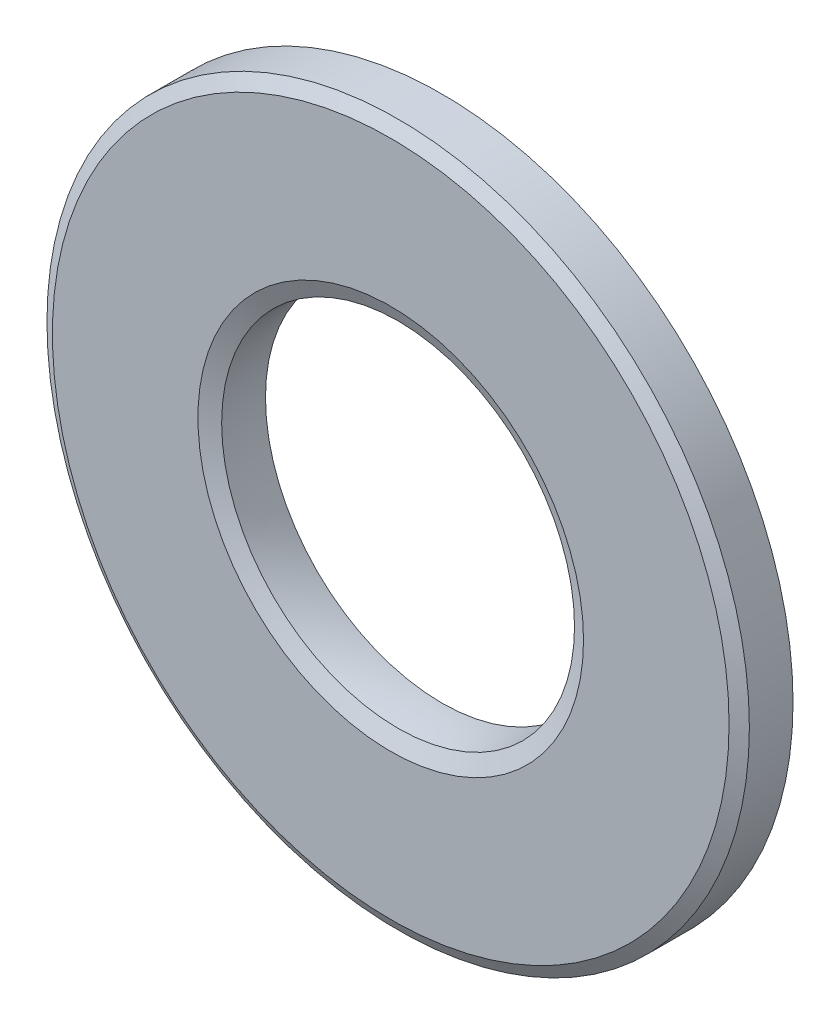
from build123d import *
from OCP.BRepFilletAPI import BRepFilletAPI_MakeChamfer

# Parameters (mm, degrees)
BOSS_EXTRUDE1_DEPTH      = 1
BOSS_EXTRUDE1_DEPTH_BACK = 1
SKETCH3_R                = 12
SKETCH3_R_2              = 6
CHAMFER1_SIZE            = 0.254
CHAMFER1_SIZE2           = 0.439940905
CHAMFER2_SIZE            = 0.536952942


with BuildPart() as part:
    # Sketch3 → Boss-Extrude1 (new, two sides: drawn at the far end of the back side and taken through both)
    with BuildSketch(Plane.XY.offset(-BOSS_EXTRUDE1_DEPTH_BACK)):
        Circle(SKETCH3_R)
        Circle(SKETCH3_R_2, mode=Mode.SUBTRACT)
    extrude(amount=BOSS_EXTRUDE1_DEPTH + BOSS_EXTRUDE1_DEPTH_BACK)

    # Chamfer1: one chamfer whose edges measure the first distance from different faces: ONE call of the kernel's chamfer builder (chamfer() names one face for all edges)
    chamfer1_edges_1 = [part.edges().sort_by_distance(p)[0] for p in [
        (-12, 0, 1),
    ]]
    chamfer1_side_1 = [part.faces().sort_by_distance(p)[0] for p in [
        (-12, 0, 0.5),
    ]]
    chamfer1_edges_2 = [part.edges().sort_by_distance(p)[0] for p in [
        (-12, 0, -1),
    ]]
    chamfer1_side_2 = [part.faces().sort_by_distance(p)[0] for p in [
        (-12, 0, -0.5),
    ]]
    chamfer1 = BRepFilletAPI_MakeChamfer(part.part.solid().wrapped)
    for e in chamfer1_edges_1:
        chamfer1.Add(CHAMFER1_SIZE, CHAMFER1_SIZE2, e.wrapped, chamfer1_side_1[0].wrapped)  # the first distance lies on this face
    for e in chamfer1_edges_2:
        chamfer1.Add(CHAMFER1_SIZE, CHAMFER1_SIZE2, e.wrapped, chamfer1_side_2[0].wrapped)  # the first distance lies on this face
    add(Compound.cast(chamfer1.Shape()), mode=Mode.REPLACE)

    # Sketch4 → Cut-Revolve1 (revolve, cut)
    with BuildSketch(Plane(origin=(0, 0, 0), x_dir=(0, 0, -1), z_dir=(1, 0, 0)), mode=Mode.PRIVATE) as cut_revolve1_sk:
        with BuildLine():
            Line((-1, 5.9492), (-1, 6.0508))
            ThreePointArc((-1, 6.0508), (0, 6), (1, 6.0508))
            Line((1, 6.0508), (1, 5.9492))
            Line((1, 5.9492), (-1, 5.9492))
        make_face()
    revolve(cut_revolve1_sk.sketch.rotate(Axis((0, 0, 1), (0, 0, -1)), 90), axis=Axis((0, 0, 1), (0, 0, -1)), mode=Mode.SUBTRACT)

    # Chamfer2
    # the kernel refuses this chamfer: 0.536952942, 0.254 mm, written as the material it takes off along each edge
    with BuildSketch(Plane(origin=(0, 0, -1), x_dir=(1, 0, 0), z_dir=(0, 1, 0))) as chamfer2_piece_1:
        with BuildLine():
            Line((6.0508 + CHAMFER2_SIZE, 0), (6.028453739, -0.251168371))
            ThreePointArc((6.028453739, -0.251168371), (6.038361074, -0.130738), (6.0508, 0))
            Line((6.0508, 0), (6.0508 + CHAMFER2_SIZE, 0))
        make_face()
    revolve(axis=Axis((0, 0, -1), (0, 0, -1)), mode=Mode.SUBTRACT)
    with BuildSketch(Plane(origin=(0, 0, 1), x_dir=(1, 0, 0), z_dir=(0, 1, 0))) as chamfer2_piece_2:
        with BuildLine():
            Line((6.0508 + CHAMFER2_SIZE, 0), (6.028453739, 0.251168371))
            ThreePointArc((6.028453739, 0.251168371), (6.038361074, 0.130738), (6.0508, 0))
            Line((6.0508, 0), (6.0508 + CHAMFER2_SIZE, 0))
        make_face()
    revolve(axis=Axis((0, 0, 1), (0, 0, -1)), mode=Mode.SUBTRACT)


solid = part.part
